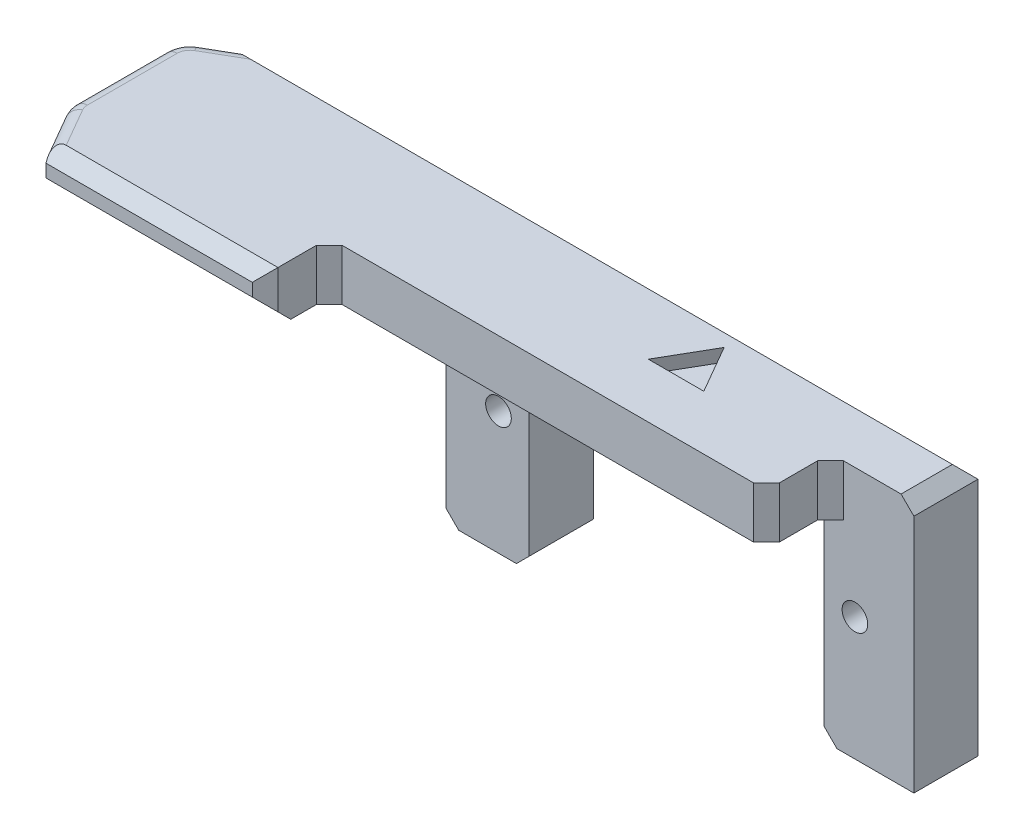
from build123d import *
from OCP.BRepFilletAPI import BRepFilletAPI_MakeChamfer

# Parameters (mm, degrees)
SKETCH1_W           = 36.5
SKETCH1_H           = 19.2
BOSS_EXTRUDE1_DEPTH = 5
SKETCH2_R           = 1
SKETCH2_W           = 23
SKETCH2_H           = 15.7
CUT_EXTRUDE3_DEPTH  = 67.428509309
SKETCH4_W           = 60
SKETCH4_H           = 15
BOSS_EXTRUDE2_DEPTH = 0.5
BOSS_EXTRUDE3_DEPTH = 3.5
CHAMFER1_SIZE       = 2
CHAMFER2_SIZE       = 1
CHAMFER3_SIZE       = 4
CHAMFER3_SIZE2      = 2.309401077
FILLET1_R           = 2
CUT_EXTRUDE4_DEPTH  = 1
FILLET2_R           = 1
CUT_EXTRUDE5_DEPTH  = 10
CHAMFER4_SIZE       = 1


with BuildPart() as part:
    # Sketch1 → Boss-Extrude1 (new body)
    with BuildSketch(Plane.XY):
        with Locations((-1.102631579, 53.75)):
            Rectangle(SKETCH1_W, SKETCH1_H)
    extrude(amount=BOSS_EXTRUDE1_DEPTH)

    # Sketch2 → Cut-Extrude3 (cut, through all)
    with BuildSketch(Plane.XY.offset(5)):
        with Locations((-15.252631579, 53.75)):
            Circle(SKETCH2_R)
        with Locations((12.547368421, 53.75)):
            Circle(SKETCH2_R)
        with Locations((-1.352631579, 52)):
            Rectangle(SKETCH2_W, SKETCH2_H)
    extrude(amount=-CUT_EXTRUDE3_DEPTH, mode=Mode.SUBTRACT)

    # Sketch4 → Boss-Extrude2 (add)
    with BuildSketch(Plane(origin=(0, 63.35, 0), x_dir=(1, 0, 0), z_dir=(0, 1, 0))):
        with Locations((-12.852631579, -7.5)):
            Rectangle(SKETCH4_W, SKETCH4_H)
    extrude(amount=BOSS_EXTRUDE2_DEPTH)

    # Sketch7 → Boss-Extrude3 (add)
    with BuildSketch(Plane.XZ.offset(-63.35)):
        Polygon((-19.352631579, 0), (-42.852631579, 0), (-42.852631579, 15), (-19.052631579, 15), (17.147368421, 15), (17.147368421, 5), (-19.352631579, 5), align=None)
    extrude(amount=BOSS_EXTRUDE3_DEPTH)

    # Chamfer1
    chamfer1_edges = [part.edges().sort_by_distance(p)[0] for p in [
        (-12.852631579, 59.85, 15),
    ]]
    chamfer(chamfer1_edges, length=CHAMFER1_SIZE)

    # Chamfer2
    chamfer2_edges = [part.edges().sort_by_distance(p)[0] for p in [
        (-12.852631579, 44.15, 2.5),
        (10.147368421, 44.15, 2.5),
        (17.147368421, 63.85, 7.5),
        (-12.852631579, 63.85, 0),
        (-12.852631579, 63.85, 15),
        (-19.352631579, 59.85, 2.5),
        (-19.352631579, 44.15, 2.5),
    ]]
    chamfer(chamfer2_edges, length=CHAMFER2_SIZE)

    # Chamfer3: one chamfer whose edges measure the first distance from different faces: ONE call of the kernel's chamfer builder (chamfer() names one face for all edges)
    chamfer3_edges_1 = [part.edges().sort_by_distance(p)[0] for p in [
        (-42.852631579, 61.35, 0),
    ]]
    chamfer3_side_1 = [part.faces().sort_by_distance(p)[0] for p in [
        (-18.724165987, 52, 0),
    ]]
    chamfer3_edges_2 = [part.edges().sort_by_distance(p)[0] for p in [
        (-42.852631579, 62.35, 15),
    ]]
    chamfer3_side_2 = [part.faces().sort_by_distance(p)[0] for p in [
        (-42.852631579, 61.86754386, 7.260233918),
    ]]
    chamfer3 = BRepFilletAPI_MakeChamfer(part.part.solid().wrapped)
    for e in chamfer3_edges_1:
        chamfer3.Add(CHAMFER3_SIZE, CHAMFER3_SIZE2, e.wrapped, chamfer3_side_1[0].wrapped)  # the first distance lies on this face
    for e in chamfer3_edges_2:
        chamfer3.Add(CHAMFER3_SIZE, CHAMFER3_SIZE2, e.wrapped, chamfer3_side_2[0].wrapped)  # the first distance lies on this face
    add(Compound.cast(chamfer3.Shape()), mode=Mode.REPLACE)

    # Fillet1
    fillet1_edges = [part.edges().sort_by_distance(p)[0] for p in [
        (-42.852631579, 61.85, 11),
        (-42.852631579, 61.85, 2.309401077),
    ]]
    fillet(fillet1_edges, radius=FILLET1_R)

    # Sketch8 → Cut-Extrude4 (cut)
    with BuildSketch(Plane(origin=(0, 63.85, 0), x_dir=(1, 0, 0), z_dir=(0, 1, 0))):
        Polygon((-0.652631579, -2), (-2.817695088, -5.75), (1.512431931, -5.75), align=None)
    extrude(amount=-CUT_EXTRUDE4_DEPTH, mode=Mode.SUBTRACT)

    # Fillet2
    fillet2_edges = [part.edges().sort_by_distance(p)[0] for p in [
        (-41.218656983, 63.85, 1.366025404),
        (-42.584682387, 63.85, 2.464101615),
        (-41.852631579, 63.85, 12.732050808),
        (-42.784483232, 63.85, 10.981739705),
        (-40.352631579, 59.85, 0.866025404),
        (-42.584682387, 59.85, 2.464101615),
        (-42.141306714, 59.85, 12.232050808),
        (-42.784483232, 59.85, 10.981739705),
        (-42.852631579, 63.85, 6.964101615),
        (-42.852631579, 59.85, 6.964101615),
    ]]
    fillet(fillet2_edges, radius=FILLET2_R - 0.0001)  # a hair under: the kernel refuses the full size

    # Sketch9 → Cut-Extrude5 (cut)
    with BuildSketch(Plane(origin=(0, 63.85, 0), x_dir=(1, 0, 0), z_dir=(0, 1, 0))):
        Polygon((17.147368421, -5), (10.647368421, -5), (10.647368421, -10), (-23.452631579, -10), (-23.452631579, -15), (9.647368421, -15), (17.147368421, -15), align=None)
    extrude(amount=-CUT_EXTRUDE5_DEPTH, mode=Mode.SUBTRACT)

    # Chamfer4
    chamfer4_edges = [part.edges().sort_by_distance(p)[0] for p in [
        (10.647368421, 61.85, 5),
        (-23.452631579, 61.85, 10),
        (10.647368421, 61.85, 10),
        (-23.452631579, 62.35, 15),
    ]]
    chamfer(chamfer4_edges, length=CHAMFER4_SIZE)


solid = part.part
